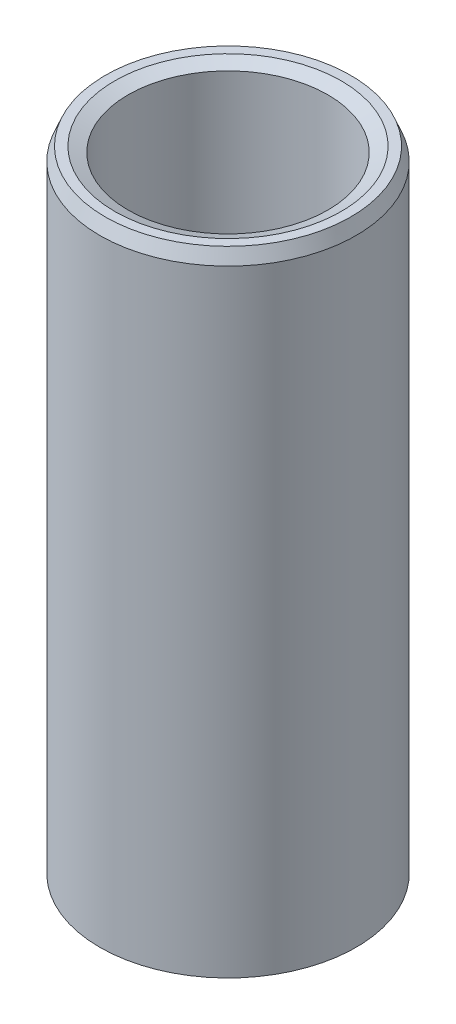
from build123d import *
from OCP.BRepFilletAPI import BRepFilletAPI_MakeChamfer

# Parameters (mm, degrees)
SKETCH1_R           = 35
BOSS_EXTRUDE1_DEPTH = 173.485702295
SKETCH2_R           = 27.279683086
CUT_EXTRUDE1_DEPTH  = 181.408671912
CHAMFER1_SIZE       = 3.64055786
CHAMFER1_SIZE2      = 1.485219702


with BuildPart() as part:
    # Sketch1 → Boss-Extrude1 (new body)
    with BuildSketch(Plane(origin=(0, 0, 0), x_dir=(1, 0, 0), z_dir=(0, 1, 0))):
        Circle(SKETCH1_R)
    extrude(amount=BOSS_EXTRUDE1_DEPTH)

    # Sketch2 → Cut-Extrude1 (cut, through all)
    with BuildSketch(Plane(origin=(0, 0, 0), x_dir=(1, 0, 0), z_dir=(0, 1, 0))):
        Circle(SKETCH2_R)
    extrude(amount=CUT_EXTRUDE1_DEPTH, mode=Mode.SUBTRACT)

    # Chamfer1: one chamfer whose edges measure the first distance from different faces: ONE call of the kernel's chamfer builder (chamfer() names one face for all edges)
    chamfer1_edges_1 = [part.edges().sort_by_distance(p)[0] for p in [
        (-27.279683086, 173.485702295, 0),
    ]]
    chamfer1_side_1 = [part.faces().sort_by_distance(p)[0] for p in [
        (-34.010050506, 173.485702295, 0),
    ]]
    chamfer1_edges_2 = [part.edges().sort_by_distance(p)[0] for p in [
        (-27.279683086, 0, 0),
    ]]
    chamfer1_side_2 = [part.faces().sort_by_distance(p)[0] for p in [
        (-27.279683086, 86.742851148, 0),
    ]]
    chamfer1_edges_3 = [part.edges().sort_by_distance(p)[0] for p in [
        (-35, 0, 0),
    ]]
    chamfer1_side_3 = [part.faces().sort_by_distance(p)[0] for p in [
        (-34.010050506, 0, 0),
    ]]
    chamfer1_edges_4 = [part.edges().sort_by_distance(p)[0] for p in [
        (-35, 173.485702295, 0),
    ]]
    chamfer1_side_4 = [part.faces().sort_by_distance(p)[0] for p in [
        (-35, 86.742851148, 0),
    ]]
    chamfer1 = BRepFilletAPI_MakeChamfer(part.part.solid().wrapped)
    for e in chamfer1_edges_1:
        chamfer1.Add(CHAMFER1_SIZE, CHAMFER1_SIZE2, e.wrapped, chamfer1_side_1[0].wrapped)  # the first distance lies on this face
    for e in chamfer1_edges_2:
        chamfer1.Add(CHAMFER1_SIZE, CHAMFER1_SIZE2, e.wrapped, chamfer1_side_2[0].wrapped)  # the first distance lies on this face
    for e in chamfer1_edges_3:
        chamfer1.Add(CHAMFER1_SIZE, CHAMFER1_SIZE2, e.wrapped, chamfer1_side_3[0].wrapped)  # the first distance lies on this face
    for e in chamfer1_edges_4:
        chamfer1.Add(CHAMFER1_SIZE, CHAMFER1_SIZE2, e.wrapped, chamfer1_side_4[0].wrapped)  # the first distance lies on this face
    add(Compound.cast(chamfer1.Shape()), mode=Mode.REPLACE)


solid = part.part
